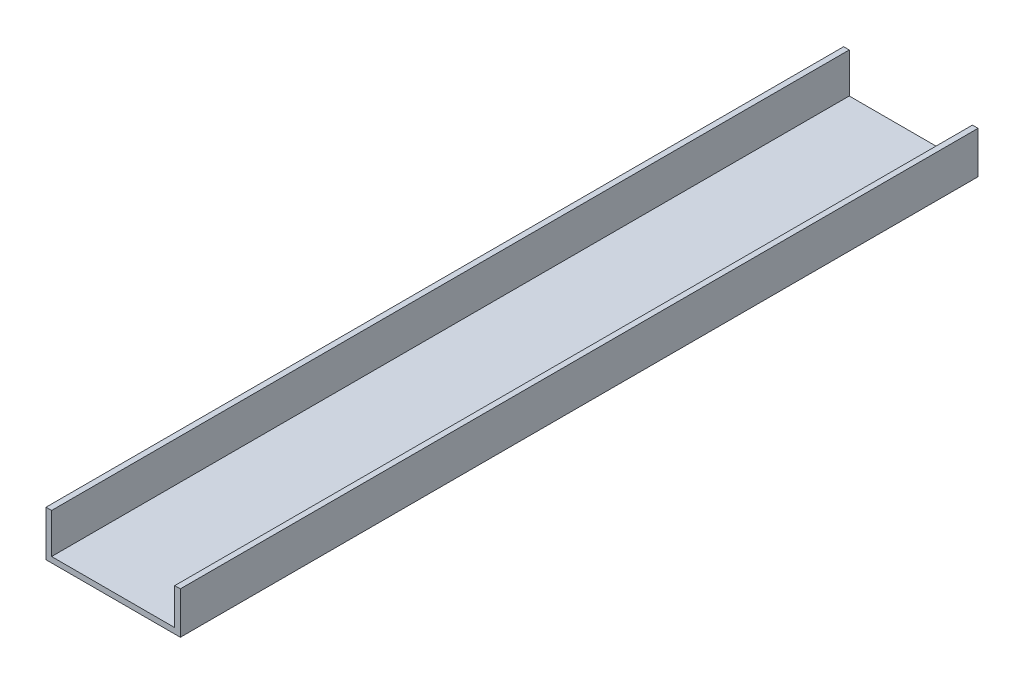
from build123d import *

# Parameters (mm, degrees)
EXTRUDE_THIN1_DEPTH = 285


with BuildPart() as part:
    # Sketch1 → Extrude-Thin1 (new body)
    with BuildSketch(Plane.XY):
        Polygon((0, 16.26035503), (0, 0), (48, 0), (48, 15), (46, 15), (46, 2), (2, 2), (2, 16.26035503), align=None)
    extrude(amount=EXTRUDE_THIN1_DEPTH)


solid = part.part
